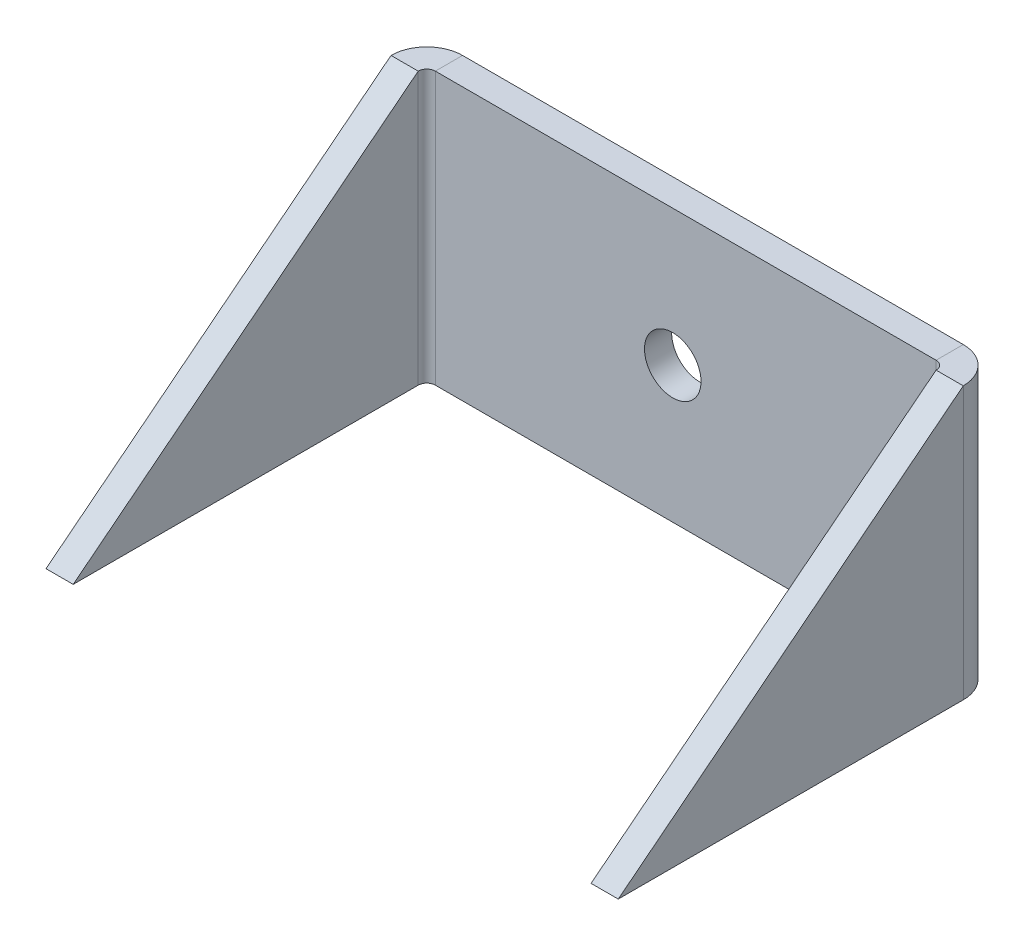
from build123d import *

# Parameters (mm, degrees)
SKETCH2_W                    = 60.452
SKETCH2_H                    = 31.75
BASE_FLANGE1_DEPTH           = 3.175
EDGE_FLANGE1_STRIP_W         = 14.7
EDGE_FLANGE1_STRIP_H         = 3.175
EDGE_FLANGE1_STRIP_CUT_DEPTH = 31.75
EDGE_FLANGE1_DEPTH           = 31.75
CUT_EXTRUDE1_START           = -3.175
CUT_EXTRUDE1_DEPTH           = 83.39755521
M6_CLEARANCE_HOLE1_D         = 6.6


# Sheet-metal steps are written as plain solids
with BuildPart() as part:
    # Sketch2 → Base-Flange1 (new body)
    with BuildSketch(Plane.XY):
        Rectangle(SKETCH2_W, SKETCH2_H)
    extrude(amount=BASE_FLANGE1_DEPTH)

    # Edge-Flange1 strip (across the edge) → Edge-Flange1 strip cut (cut)
    with BuildSketch(Plane(origin=(30.226, -15.875, 3.175), x_dir=(-1, 0, 0), z_dir=(0, 1, 0))):
        with Locations((-6.35, -1.5875)):
            Rectangle(EDGE_FLANGE1_STRIP_W, EDGE_FLANGE1_STRIP_H)
    edge_flange1_strip_cut = extrude(amount=EDGE_FLANGE1_STRIP_CUT_DEPTH, mode=Mode.SUBTRACT)

    # Edge-Flange1 section (across the edge) → Edge-Flange1 (add)
    with BuildSketch(Plane(origin=(30.226, -15.875, 3.175), x_dir=(-1, 0, 0), z_dir=(0, 1, 0))):
        with BuildLine():
            Line((-3.175, 1), (-3.175, 41.275))
            Line((-3.175, 41.275), (0, 41.275))
            Line((0, 41.275), (0, 1))
            ThreePointArc((0, 1), (0.292893219, 0.292893219), (1, 0))
            Line((1, 0), (1, -3.175))
            ThreePointArc((1, -3.175), (-1.952170811, -1.952170811), (-3.175, 1))
        make_face()
    edge_flange1 = extrude(amount=EDGE_FLANGE1_DEPTH)

    # Sketch10 → Cut-Extrude1 (cut)
    with BuildSketch(Plane(origin=(33.401, 0, 0), x_dir=(0, 0, -1), z_dir=(1, 0, 0)).offset(CUT_EXTRUDE1_START)):
        Polygon((-4.175, 15.875), (-44.45, -15.875), (-44.45, 15.875), align=None)
    cut_extrude1 = extrude(amount=CUT_EXTRUDE1_DEPTH, mode=Mode.SUBTRACT)

    # Mirror1: Edge-Flange1 strip cut, Edge-Flange1, Cut-Extrude1 across plane
    add(edge_flange1_strip_cut.mirror(Plane(origin=(0, 0, 0), x_dir=(0, 0, 1), z_dir=(1, 0, 0))), mode=Mode.SUBTRACT)
    add(edge_flange1.mirror(Plane(origin=(0, 0, 0), x_dir=(0, 0, 1), z_dir=(1, 0, 0))))
    add(cut_extrude1.mirror(Plane(origin=(0, 0, 0), x_dir=(0, 0, 1), z_dir=(1, 0, 0))), mode=Mode.SUBTRACT)

    # M6 Clearance Hole1 (through all)
    with Locations(Plane.XY.offset(3.175)):
        with Locations((-1.5146, 0)):
            Hole(M6_CLEARANCE_HOLE1_D / 2)


solid = part.part
